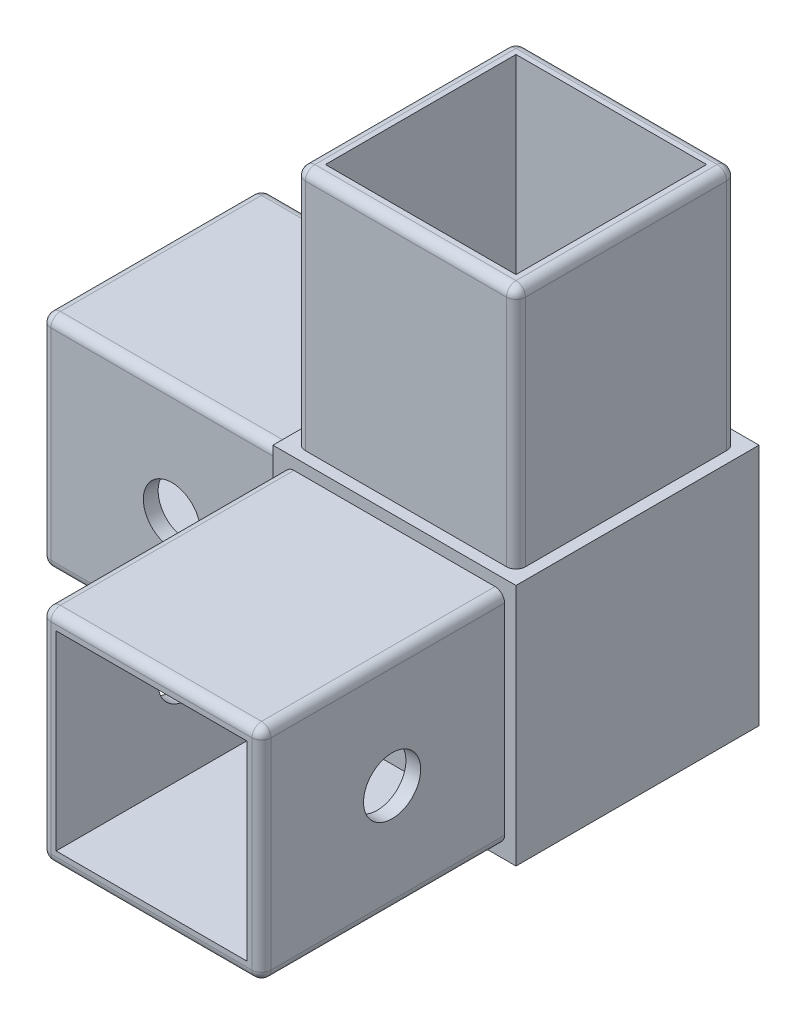
from build123d import *

# Parameters (mm, degrees)
SKETCH1_W                = 25.5
SKETCH1_H                = 25.5
BOSS_EXTRUDE1_DEPTH      = 25.5
SKETCH2_W                = 23.1
SKETCH2_H                = 23.1
SKETCH2_W_2              = 20
SKETCH2_H_2              = 20
BOSS_EXTRUDE2_DEPTH      = 25.5
SKETCH3_W                = 23.1
SKETCH3_H                = 23.1
SKETCH3_W_2              = 20
SKETCH3_H_2              = 20
BOSS_EXTRUDE3_DEPTH      = 25.5
SKETCH4_W                = 23.1
SKETCH4_H                = 23.1
SKETCH4_W_2              = 20
SKETCH4_H_2              = 20
BOSS_EXTRUDE4_DEPTH      = 25.5
FILLET4_R                = 1
F_6_0_6_DIAMETER_HOLE1_D = 6
F_6_0_6_DIAMETER_HOLE2_D = 6


with BuildPart() as part:
    # Sketch1 → Boss-Extrude1 (new body)
    with BuildSketch(Plane.XY):
        Rectangle(SKETCH1_W, SKETCH1_H)
    extrude(amount=BOSS_EXTRUDE1_DEPTH)

    # Sketch2 → Boss-Extrude2 (add)
    with BuildSketch(Plane(origin=(0, 12.75, 0), x_dir=(1, 0, 0), z_dir=(0, 1, 0))):
        with Locations((0, -12.75)):
            Rectangle(SKETCH2_W, SKETCH2_H)
        with Locations((0, -12.75)):
            Rectangle(SKETCH2_W_2, SKETCH2_H_2, mode=Mode.SUBTRACT)
    extrude(amount=BOSS_EXTRUDE2_DEPTH)

    # Sketch3 → Boss-Extrude3 (add)
    with BuildSketch(Plane.XY.offset(25.5)):
        Rectangle(SKETCH3_W, SKETCH3_H)
        Rectangle(SKETCH3_W_2, SKETCH3_H_2, mode=Mode.SUBTRACT)
    extrude(amount=BOSS_EXTRUDE3_DEPTH)

    # Sketch4 → Boss-Extrude4 (add)
    with BuildSketch(Plane.ZY.offset(12.75)):
        with Locations((12.75, 0)):
            Rectangle(SKETCH4_W, SKETCH4_H)
        with Locations((12.75, 0)):
            Rectangle(SKETCH4_W_2, SKETCH4_H_2, mode=Mode.SUBTRACT)
    extrude(amount=BOSS_EXTRUDE4_DEPTH)

    # Fillet4
    fillet4_edges = [part.edges().sort_by_distance(p)[0] for p in [
        (-11.55, 25.5, 24.3),
        (-11.55, 25.5, 1.2),
        (11.55, 25.5, 1.2),
        (11.55, 25.5, 24.3),
        (11.55, -11.55, 38.25),
        (-11.55, -11.55, 38.25),
        (11.55, 11.55, 38.25),
        (-11.55, 11.55, 38.25),
        (-25.5, -11.55, 24.3),
        (-25.5, -11.55, 1.2),
        (-25.5, 11.55, 1.2),
        (-25.5, 11.55, 24.3),
        (-38.25, 0, 24.3),
        (-38.25, 0, 1.2),
        (-38.25, -11.55, 12.75),
        (-38.25, 11.55, 12.75),
        (11.55, 0, 51),
        (0, -11.55, 51),
        (-11.55, 0, 51),
        (0, 11.55, 51),
        (0, 38.25, 1.2),
        (-11.55, 38.25, 12.75),
        (0, 38.25, 24.3),
        (11.55, 38.25, 12.75),
    ]]
    fillet(fillet4_edges, radius=FILLET4_R)

    # Ø6.0 (6) Diameter Hole1 (through all)
    with Locations(Plane(origin=(0, 0, 1.2), x_dir=(-1, 0, 0), z_dir=(0, 0, -1))):
        with Locations((24.55, -0.15)):
            Hole(F_6_0_6_DIAMETER_HOLE1_D / 2)

    # Ø6.0 (6) Diameter Hole2 (through all)
    with Locations(Plane(origin=(11.55, 0, 0), x_dir=(0, 0, -1), z_dir=(1, 0, 0))):
        with Locations((-37.3, -0.15)):
            Hole(F_6_0_6_DIAMETER_HOLE2_D / 2)


solid = part.part
